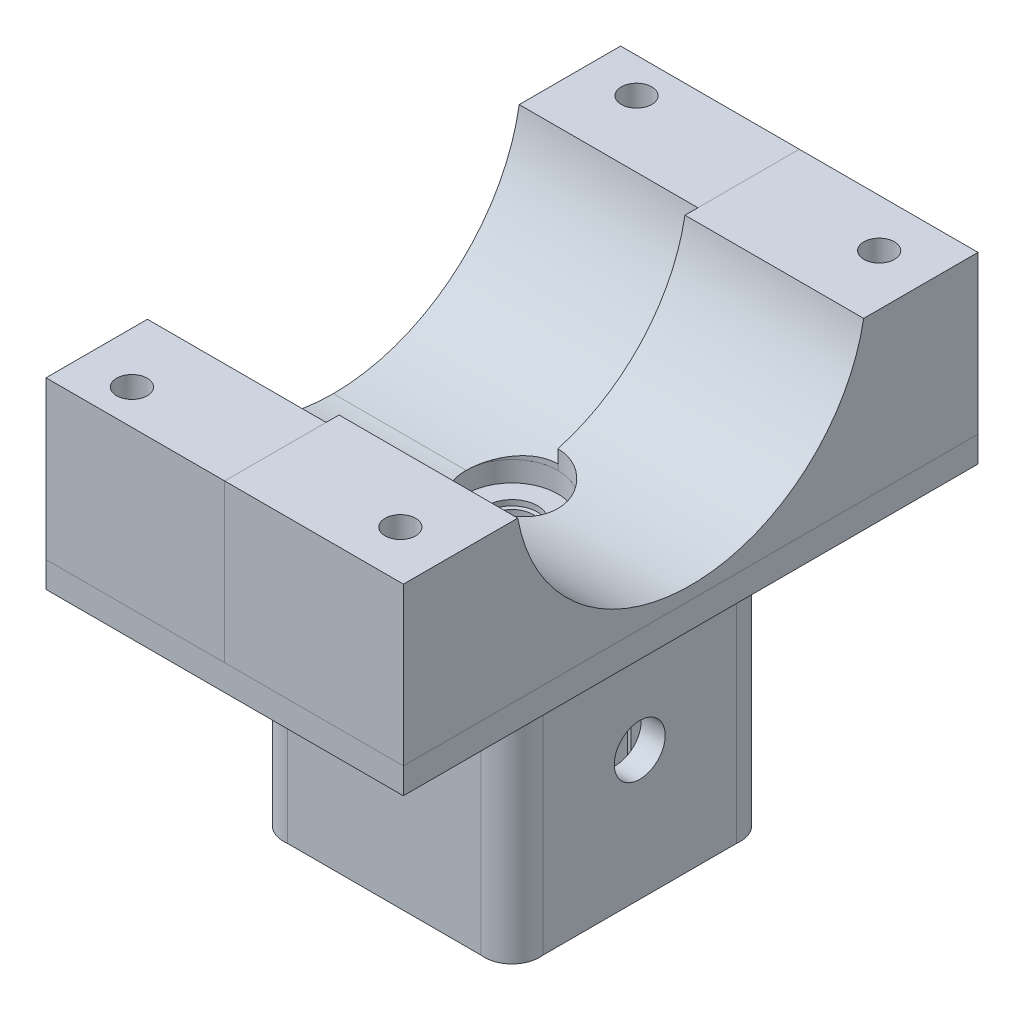
from build123d import *

# Parameters (mm, degrees)
SKETCH2_R               = 2.074585303
VSLOT2020_2020_5_DEPTH  = 25.4
BOSS_EXTRUDE1_START     = -25.4
SKETCH3_W               = 20.35355339
SKETCH3_H               = 20.35355339
BOSS_EXTRUDE1_DEPTH     = 25.4
CUT_EXTRUDE1_REACH      = 44.242
SKETCH5_R               = 2.5
SKETCH10_R              = 2.5
BOSS_EXTRUDE2_DEPTH     = 2.54
BOSS_EXTRUDE3_DEPTH     = 2.54
RIB22_REACH             = 52.473
SKETCH15_WALL_W         = 119.363005456
SKETCH15_WALL_H         = 20.32
SKETCH16_R              = 1.5
CUT_EXTRUDE3_DEPTH      = 2.54
SKETCH17_R              = 4.5
CUT_EXTRUDE4_DEPTH      = 2
CUT_EXTRUDE2_REACH      = 58.078
BOSS_EXTRUDE6_DEPTH     = 17.54
BOSS_EXTRUDE6_2_DEPTH   = 17.54
BOSS_EXTRUDE7_DEPTH     = 17.54
CUT_EXTRUDE7_DEPTH      = 54.505622126
CUT_EXTRUDE7_DEPTH_BACK = 54.505622126
SKETCH27_R              = 2.5
SKETCH27_R_2            = 1.5
CUT_EXTRUDE8_DEPTH      = 65.035593734
CUT_EXTRUDE8_DEPTH_BACK = 17.452
SKETCH28_R              = 4.5


with BuildPart() as part:
    # Sketch2 → Vslot2020 2020(5) (new body)
    with BuildSketch(Plane.ZX):
        with BuildLine():
            Line((13.9, 7.149086807), (13.9, 12.844511469))
            Line((13.9, 12.844511469), (16.558493656, 15.492177728))
            Line((16.558493656, 15.492177728), (16.550703242, 15.5))
            Line((16.550703242, 15.5), (18.2, 15.5))
            Line((18.2, 15.5), (18.2, 13.12))
            Line((18.2, 13.12), (18.534428266, 13.12))
            Line((18.534428266, 13.12), (20, 14.58))
            Line((20, 14.58), (20, 19.5))
            ThreePointArc((20, 19.5), (19.853553391, 19.853553391), (19.5, 20))
            Line((19.5, 20), (14.575, 20))
            Line((14.575, 20), (13.12, 18.545))
            Line((13.12, 18.545), (13.12, 18.2))
            Line((13.12, 18.2), (15.5, 18.2))
            Line((15.5, 18.2), (15.5, 16.555))
            Line((15.5, 16.555), (12.834142613, 13.9))
            Line((12.834142613, 13.9), (7.155, 13.9))
            Line((7.155, 13.9), (4.5, 16.555))
            Line((4.5, 16.555), (4.5, 18.2))
            Line((4.5, 18.2), (6.875, 18.2))
            Line((6.875, 18.2), (6.875, 18.545))
            Line((6.875, 18.545), (5.42, 20))
            Line((5.42, 20), (0.5, 20))
            ThreePointArc((0.5, 20), (0.146446609, 19.853553391), (0, 19.5))
            Line((0, 19.5), (0, 14.58))
            Line((0, 14.58), (1.46, 13.12))
            Line((1.46, 13.12), (1.8, 13.12))
            Line((1.8, 13.12), (1.8, 15.5))
            Line((1.8, 15.5), (3.445, 15.5))
            Line((3.445, 15.5), (3.439339828, 15.494339828))
            Line((3.439339828, 15.494339828), (6.094339828, 12.839339828))
            Line((6.094339828, 12.839339828), (6.1, 12.845))
            Line((6.1, 12.845), (6.1, 7.149086807))
            Line((6.1, 7.149086807), (3.439339828, 4.5))
            Line((3.439339828, 4.5), (1.8, 4.5))
            Line((1.8, 4.5), (1.8, 6.88))
            Line((1.8, 6.88), (1.46, 6.88))
            Line((1.46, 6.88), (0, 5.42))
            Line((0, 5.42), (0, 0.5))
            ThreePointArc((0, 0.5), (0.146446609, 0.146446609), (0.5, 0))
            Line((0.5, 0), (5.42, 0))
            Line((5.42, 0), (6.875, 1.455))
            Line((6.875, 1.455), (6.875, 1.8))
            Line((6.875, 1.8), (4.5, 1.8))
            Line((4.5, 1.8), (4.5, 3.4393348))
            Line((4.5, 3.4393348), (7.158345795, 6.086117297))
            Line((7.158345795, 6.086117297), (7.144523479, 6.1))
            Line((7.144523479, 6.1), (12.854625295, 6.1))
            Line((12.854625295, 6.1), (12.841221344, 6.086548451))
            Line((12.841221344, 6.086548451), (15.499715, 3.437461644))
            Line((15.499715, 3.437461644), (15.5, 1.8))
            Line((15.5, 1.8), (13.12, 1.8))
            Line((13.12, 1.8), (13.12, 1.455))
            Line((13.12, 1.455), (14.575, 0))
            Line((14.575, 0), (19.5, 0))
            ThreePointArc((19.5, 0), (19.853553391, 0.146446609), (20, 0.5))
            Line((20, 0.5), (20, 5.42))
            Line((20, 5.42), (18.606904708, 6.88))
            Line((18.606904708, 6.88), (18.2, 6.88))
            Line((18.2, 6.88), (18.2, 4.5))
            Line((18.2, 4.5), (16.558493656, 4.5))
            Line((16.558493656, 4.5), (13.9, 7.149086807))
        make_face()
        with Locations((10, 10)):
            Circle(SKETCH2_R, mode=Mode.SUBTRACT)
    extrude(amount=VSLOT2020_2020_5_DEPTH)


with BuildPart() as body_2:
    # Sketch3 → Boss-Extrude1 (new body)
    with BuildSketch(Plane.XZ.offset(BOSS_EXTRUDE1_START)):
        with BuildLine():
            Line((22.54, 0.5), (22.54, 19.5))
            ThreePointArc((22.54, 19.5), (21.769538175, 21.769538175), (19.5, 22.54))
            Line((19.5, 22.54), (0.5, 22.54))
            ThreePointArc((0.5, 22.54), (-1.769538175, 21.769538175), (-2.54, 19.5))
            Line((-2.54, 19.5), (-2.54, 0.5))
            ThreePointArc((-2.54, 0.5), (-1.769538175, -1.769538175), (0.5, -2.54))
            Line((0.5, -2.54), (19.5, -2.54))
            ThreePointArc((19.5, -2.54), (21.769538175, -1.769538175), (22.54, 0.5))
        make_face()
        with Locations((10, 10)):
            Rectangle(SKETCH3_W, SKETCH3_H, mode=Mode.SUBTRACT)
    extrude(amount=BOSS_EXTRUDE1_DEPTH)

    # Cut-Extrude1: up to this face of the body (flat: up to its plane)
    cut_extrude1_end = Plane(body_2.part.faces().sort_by_distance((10, 12.7, -2.54))[0])
    # Sketch5 → Cut-Extrude1 (cut, up to the picked face)
    with BuildSketch(Plane.XY.offset(22.54), mode=Mode.PRIVATE) as cut_extrude1_sk1:
        with Locations((10, 12.7)):
            Circle(SKETCH5_R)
    cut_extrude1_tool1 = split(extrude(cut_extrude1_sk1.sketch, amount=-CUT_EXTRUDE1_REACH, mode=Mode.PRIVATE), bisect_by=cut_extrude1_end, keep=Keep.BOTH, mode=Mode.PRIVATE)
    add(cut_extrude1_tool1.solids().sort_by(Axis((10, 12.7, 22.54), (0, 0, -1)))[0], mode=Mode.SUBTRACT)


with BuildPart() as body_3:
    # Sketch10 → Boss-Extrude2 (new body)
    with BuildSketch(Plane(origin=(0, 25.4, 0), x_dir=(1, 0, 0), z_dir=(0, 1, 0))):
        with BuildLine():
            Line((22.54, -19.5), (22.54, -0.5))
            ThreePointArc((22.54, -0.5), (21.769538175, 1.769538175), (19.5, 2.54))
            Line((19.5, 2.54), (0.5, 2.54))
            ThreePointArc((0.5, 2.54), (-1.769538175, 1.769538175), (-2.54, -0.5))
            Line((-2.54, -0.5), (-2.54, -19.5))
            ThreePointArc((-2.54, -19.5), (-1.769538175, -21.769538175), (0.5, -22.54))
            Line((0.5, -22.54), (19.5, -22.54))
            ThreePointArc((19.5, -22.54), (21.769538175, -21.769538175), (22.54, -19.5))
        make_face()
        with Locations(Location((10, -10, 0), (0, 0, 270))):
            Circle(SKETCH10_R, mode=Mode.SUBTRACT)
    extrude(amount=BOSS_EXTRUDE2_DEPTH)


with BuildPart() as body_4:
    # Sketch12 → Boss-Extrude3 (new body)
    with BuildSketch(Plane(origin=(0, 27.94, 0), x_dir=(1, 0, 0), z_dir=(0, 1, 0))):
        with BuildLine():
            Line((-7.54, -38.199999988), (-2.54, -38.199999988))
            Line((-2.54, -38.199999988), (-2.54, -20.207106781))
            ThreePointArc((-2.54, -20.207106781), (-2.563165057, -19.853553391), (-2.54, -19.5))
            Line((-2.54, -19.5), (-2.54, -0.5))
            ThreePointArc((-2.54, -0.5), (-2.563165057, -0.146446609), (-2.54, 0.207106781))
            Line((-2.54, 0.207106781), (-2.54, 18.199999988))
            Line((-2.54, 18.199999988), (-7.54, 18.199999988))
            Line((-7.54, 18.199999988), (-7.54, -38.199999988))
        make_face()
        with BuildLine():
            Line((22.54, -0.5), (22.54, -19.5))
            ThreePointArc((22.54, -19.5), (22.563165057, -19.853553391), (22.54, -20.207106781))
            Line((22.54, -20.207106781), (22.54, -38.199999988))
            Line((22.54, -38.199999988), (27.54, -38.199999988))
            Line((27.54, -38.199999988), (27.54, 18.199999988))
            Line((27.54, 18.199999988), (22.54, 18.199999988))
            Line((22.54, 18.199999988), (22.54, 0.207106781))
            ThreePointArc((22.54, 0.207106781), (22.563165057, -0.146446609), (22.54, -0.5))
        make_face()
        with BuildLine():
            ThreePointArc((19.5, 2.54), (21.503158005, 2.003158005), (22.54, 0.207106781))
            Line((22.54, 0.207106781), (22.54, 18.199999988))
            Line((22.54, 18.199999988), (-2.54, 18.199999988))
            Line((-2.54, 18.199999988), (-2.54, 0.207106781))
            ThreePointArc((-2.54, 0.207106781), (-1.503158005, 2.003158005), (0.5, 2.54))
            Line((0.5, 2.54), (19.5, 2.54))
        make_face()
        with BuildLine():
            Line((22.54, -38.199999988), (22.54, -20.207106781))
            ThreePointArc((22.54, -20.207106781), (21.503158005, -22.003158005), (19.5, -22.54))
            Line((19.5, -22.54), (0.5, -22.54))
            ThreePointArc((0.5, -22.54), (-1.503158005, -22.003158005), (-2.54, -20.207106781))
            Line((-2.54, -20.207106781), (-2.54, -38.199999988))
            Line((-2.54, -38.199999988), (22.54, -38.199999988))
        make_face()
    extrude(amount=-BOSS_EXTRUDE3_DEPTH)

    # Combine1: union body 3, body 2
    add(body_3.part)
    add(body_2.part)

    # Sketch15 wall → Rib22 (add, up to next)
    with BuildSketch(Plane(origin=(10, 22.9, -10.381582522), x_dir=(0, -0.304566458614, 0.952491087773), z_dir=(0, 0.952491087773, 0.304566458614)), mode=Mode.PRIVATE) as rib22_sk1:
        Rectangle(SKETCH15_WALL_W, SKETCH15_WALL_H)
    rib22_tool1 = extrude(rib22_sk1.sketch, amount=RIB22_REACH, mode=Mode.PRIVATE) - body_4.part
    rib22 = rib22_tool1.solids().sort_by_distance((10, 22.9, -10.381582522))[0]
    add(rib22)

    # Mirror5: Rib22 across plane
    add(rib22.mirror(Plane.XY.offset(10)))

    # Sketch16 → Cut-Extrude3 (cut)
    with BuildSketch(Plane(origin=(0, 27.94, 0), x_dir=(1, 0, 0), z_dir=(0, 1, 0))):
        with Locations(Location((-2.54, 14.765, 0), (0, 0, 270))):
            Circle(SKETCH16_R)
        with Locations(Location((22.54, 13.49999999, 0), (0, 0, 270))):
            Circle(SKETCH16_R)
        with Locations(Location((-2.54, -34.765, 0), (0, 0, 270))):
            Circle(SKETCH16_R)
        with Locations(Location((22.54, -33.49999999, 0), (0, 0, 270))):
            Circle(SKETCH16_R)
    extrude(amount=-CUT_EXTRUDE3_DEPTH, mode=Mode.SUBTRACT)

    # Sketch17 → Cut-Extrude4 (cut)
    with BuildSketch(Plane(origin=(0, 27.94, 0), x_dir=(1, 0, 0), z_dir=(0, 1, 0))):
        with Locations(Location((10, -10, 0), (0, 0, 270))):
            Circle(SKETCH17_R)
    extrude(amount=-CUT_EXTRUDE4_DEPTH, mode=Mode.SUBTRACT)

    # Cut-Extrude2: up to this face of the body (flat: up to its plane)
    cut_extrude2_end = Plane(body_4.part.faces().sort_by_distance((22.54, 12.7, 10))[0])
    # Sketch6 → Cut-Extrude2 (cut, up to the picked face)
    with BuildSketch(Plane.ZY.offset(2.54), mode=Mode.PRIVATE) as cut_extrude2_sk1:
        with BuildLine():
            ThreePointArc((12.5, 12.7), (11.767766953, 14.467766953), (10, 15.2))
            Line((10, 15.2), (10, 10.2))
            ThreePointArc((10, 10.2), (11.767766953, 10.932233047), (12.5, 12.7))
        make_face()
    cut_extrude2_tool1 = split(extrude(cut_extrude2_sk1.sketch, amount=-CUT_EXTRUDE2_REACH, mode=Mode.PRIVATE), bisect_by=cut_extrude2_end, keep=Keep.BOTH, mode=Mode.PRIVATE)
    # Sketch6 → Cut-Extrude2 (cut, up to the picked face)
    with BuildSketch(Plane.ZY.offset(2.54), mode=Mode.PRIVATE) as cut_extrude2_sk2:
        with BuildLine():
            Line((10, 10.2), (10, 15.2))
            ThreePointArc((10, 15.2), (7.5, 12.7), (10, 10.2))
        make_face()
    cut_extrude2_tool2 = split(extrude(cut_extrude2_sk2.sketch, amount=-CUT_EXTRUDE2_REACH, mode=Mode.PRIVATE), bisect_by=cut_extrude2_end, keep=Keep.BOTH, mode=Mode.PRIVATE)
    # Sketch6 → Cut-Extrude2 (cut, up to the picked face)
    with BuildSketch(Plane.ZY.offset(2.54), mode=Mode.PRIVATE) as cut_extrude2_sk3:
        with BuildLine():
            ThreePointArc((12.5, 12.7), (11.767766953, 14.467766953), (10, 15.2))
            Line((10, 15.2), (10, 10.2))
            ThreePointArc((10, 10.2), (11.767766953, 10.932233047), (12.5, 12.7))
        make_face()
    cut_extrude2_tool3 = split(extrude(cut_extrude2_sk3.sketch, amount=-CUT_EXTRUDE2_REACH, mode=Mode.PRIVATE), bisect_by=cut_extrude2_end, keep=Keep.BOTH, mode=Mode.PRIVATE)
    # Sketch6 → Cut-Extrude2 (cut, up to the picked face)
    with BuildSketch(Plane.ZY.offset(2.54), mode=Mode.PRIVATE) as cut_extrude2_sk4:
        with BuildLine():
            Line((10, 10.2), (10, 15.2))
            ThreePointArc((10, 15.2), (7.5, 12.7), (10, 10.2))
        make_face()
    cut_extrude2_tool4 = split(extrude(cut_extrude2_sk4.sketch, amount=-CUT_EXTRUDE2_REACH, mode=Mode.PRIVATE), bisect_by=cut_extrude2_end, keep=Keep.BOTH, mode=Mode.PRIVATE)
    add(cut_extrude2_tool1.solids().sort_by(Axis((-2.54, 12.7, 11.061033), (1, 0, 0)))[0], mode=Mode.SUBTRACT)
    add(cut_extrude2_tool2.solids().sort_by(Axis((-2.54, 12.7, 8.938967), (1, 0, 0)))[0], mode=Mode.SUBTRACT)
    add(cut_extrude2_tool3.solids().sort_by(Axis((-2.54, 12.7, 11.061033), (1, 0, 0)))[0], mode=Mode.SUBTRACT)
    add(cut_extrude2_tool4.solids().sort_by(Axis((-2.54, 12.7, 8.938967), (1, 0, 0)))[0], mode=Mode.SUBTRACT)


with BuildPart() as body_3_2:
    # Sketch23 → Boss-Extrude6 (new body)
    with BuildSketch(Plane.ZY.offset(7.54)):
        with BuildLine():
            Line((-18.199999988, 43.391999957), (-18.199999988, 27.94))
            Line((-18.199999988, 27.94), (10, 27.94))
            ThreePointArc((10, 27.94), (-1.95537533, 32.32196188), (-8.247183191, 43.391999957))
            Line((-8.247183191, 43.391999957), (-18.199999988, 43.391999957))
        make_face()
    extrude(amount=-BOSS_EXTRUDE6_DEPTH)


with BuildPart() as body_4_2:
    # Sketch23 → Boss-Extrude6 2 (new body)
    with BuildSketch(Plane.ZY.offset(7.54)):
        with BuildLine():
            ThreePointArc((28.247183191, 43.391999957), (21.95537533, 32.32196188), (10, 27.94))
            Line((10, 27.94), (38.199999988, 27.94))
            Line((38.199999988, 27.94), (38.199999988, 43.391999957))
            Line((38.199999988, 43.391999957), (28.247183191, 43.391999957))
        make_face()
    extrude(amount=-BOSS_EXTRUDE6_2_DEPTH)


with BuildPart() as body_5:
    # Sketch24 → Boss-Extrude7 (new body)
    with BuildSketch(Plane(origin=(27.54, 0, 0), x_dir=(0, 0, -1), z_dir=(1, 0, 0))):
        with BuildLine():
            Line((-28.247183191, 43.391999957), (-38.199999988, 43.391999957))
            Line((-38.199999988, 43.391999957), (-38.199999988, 27.94))
            Line((-38.199999988, 27.94), (18.199999988, 27.94))
            Line((18.199999988, 27.94), (18.199999988, 43.391999957))
            Line((18.199999988, 43.391999957), (8.247183191, 43.391999957))
            Line((8.247183191, 43.391999957), (6.978580551, 43.391999957))
            ThreePointArc((6.978580551, 43.391999957), (-10, 29.189999913), (-26.978580551, 43.391999957))
            Line((-26.978580551, 43.391999957), (-28.247183191, 43.391999957))
        make_face()
    extrude(amount=-BOSS_EXTRUDE7_DEPTH)


with BuildPart() as cut_extrude7_tool:
    # Sketch27 → Cut-Extrude7 (new, two sides: drawn at the far end of the back side and taken through both)
    with BuildSketch(Plane.XZ.offset(-25.4).offset(-CUT_EXTRUDE7_DEPTH_BACK)):
        with Locations(Location((10, 10, 0), (0, 0, 90))):
            Circle(SKETCH27_R)
        with Locations(Location((-2.54, 34.765, 0), (0, 0, 270))):
            Circle(SKETCH27_R_2)
        with Locations(Location((-2.54, -14.765, 0), (0, 0, 270))):
            Circle(SKETCH27_R_2)
        with Locations(Location((22.54, -13.49999999, 0), (0, 0, 270))):
            Circle(SKETCH27_R_2)
        with Locations(Location((22.54, 33.49999999, 0), (0, 0, 270))):
            Circle(SKETCH27_R_2)
    extrude(amount=CUT_EXTRUDE7_DEPTH + CUT_EXTRUDE7_DEPTH_BACK)


with BuildPart() as body_3_2_1:
    add(body_3_2.part)

    # Cut-Extrude7: cut by cut_extrude7_tool
    add(cut_extrude7_tool.part, mode=Mode.SUBTRACT)


with BuildPart() as body_4_2_1:
    add(body_4_2.part)

    # Cut-Extrude7: cut by cut_extrude7_tool
    add(cut_extrude7_tool.part, mode=Mode.SUBTRACT)


with BuildPart() as body_5_1:
    add(body_5.part)

    # Cut-Extrude7: cut by cut_extrude7_tool
    add(cut_extrude7_tool.part, mode=Mode.SUBTRACT)


with BuildPart() as cut_extrude8_tool:
    # Sketch28 → Cut-Extrude8 (new, two sides: drawn at the far end of the back side and taken through both)
    with BuildSketch(Plane(origin=(0, 43.391999957, 0), x_dir=(1, 0, 0), z_dir=(0, 1, 0)).offset(-CUT_EXTRUDE8_DEPTH_BACK)):
        with Locations(Location((10, -10, 0), (0, 0, 270))):
            Circle(SKETCH28_R)
    extrude(amount=CUT_EXTRUDE8_DEPTH + CUT_EXTRUDE8_DEPTH_BACK)


with BuildPart() as body_3_2_2:
    add(body_3_2_1.part)

    # Cut-Extrude8: cut by cut_extrude8_tool
    add(cut_extrude8_tool.part, mode=Mode.SUBTRACT)


with BuildPart() as body_4_2_2:
    add(body_4_2_1.part)

    # Cut-Extrude8: cut by cut_extrude8_tool
    add(cut_extrude8_tool.part, mode=Mode.SUBTRACT)


with BuildPart() as body_5_2:
    add(body_5_1.part)

    # Cut-Extrude8: cut by cut_extrude8_tool
    add(cut_extrude8_tool.part, mode=Mode.SUBTRACT)


solid = Compound([part.part, body_4.part, body_3_2_2.part, body_4_2_2.part, body_5_2.part])
